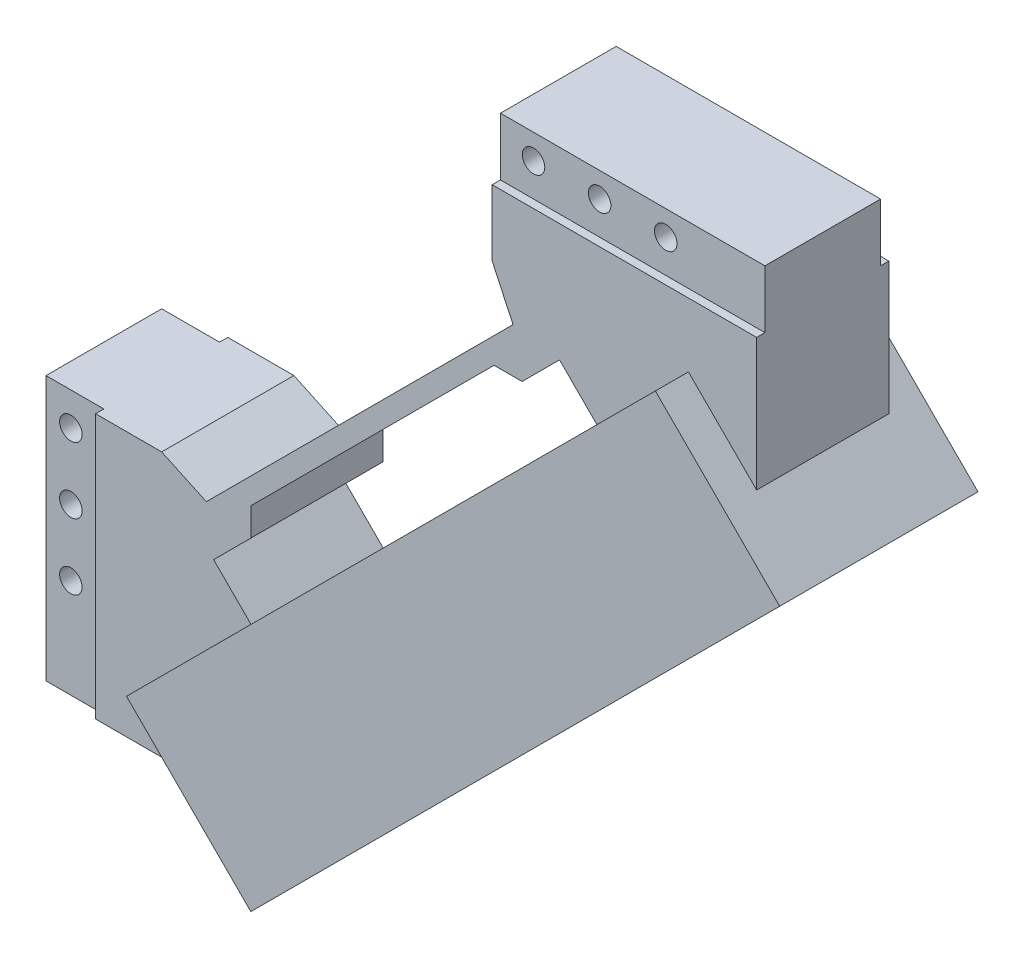
from build123d import *

# Parameters (mm, degrees)
SKETCH3_W                = 11.1125
SKETCH3_H                = 50.8
SKETCH3_W_2              = 50.8
SKETCH3_H_2              = 11.1125
BOSS_EXTRUDE2_DEPTH      = 25.4
SKETCH5_W                = 50.8
SKETCH5_H                = 12.7
SKETCH5_W_2              = 12.7
SKETCH5_H_2              = 50.8
CUT_EXTRUDE1_DEPTH       = 1.5875
SKETCH6_W                = 50.8
SKETCH6_H                = 12.7
SKETCH6_W_2              = 12.7
SKETCH6_H_2              = 50.8
CUT_EXTRUDE2_DEPTH       = 1.5875
SKETCH7_R                = 2.159
CUT_EXTRUDE4_DEPTH       = 25.4
F_3DSKETCH2_R            = 11.1125
F_3DSKETCH2_R_2          = 4.572
F_3DSKETCH2_R_3          = 19.05
F_3DSKETCH2_R_4          = 2.413
BOSS_EXTRUDE5_DEPTH      = 18.539434278
CUT_EXTRUDE9_START       = 89.71230509
CUT_EXTRUDE9_OUTLINE_R   = 4.572
CUT_EXTRUDE9_DEPTH       = 36.011280605
F_3DSKETCH2_11_R         = 2.413
CUT_EXTRUDE10_DEPTH      = 36.011280605
BOSS_EXTRUDE7_START      = -21.079434
SKETCH10_W               = 38.1
SKETCH10_H               = 143.684097938
SKETCH10_R               = 4.572
BOSS_EXTRUDE7_DEPTH      = 33.779434
CUT_EXTRUDE13_DEPTH      = 12.7
CUT_EXTRUDE13_DEPTH_BACK = 2.54
CUT_EXTRUDE14_DEPTH      = 12.7
SKETCH10_9_R             = 6.113994518
CUT_EXTRUDE15_DEPTH      = 4.064
SKETCH10_10_R            = 2.413
CUT_EXTRUDE16_DEPTH      = 18.288
CUT_EXTRUDE17_START      = -18.539434
F_3DSKETCH2_12_R         = 11.1125
F_3DSKETCH2_12_R_2       = 4.572
CUT_EXTRUDE17_DEPTH      = 7.1374
BOSS_EXTRUDE8_DEPTH      = 25.4
BOSS_EXTRUDE9_DEPTH      = 25.4
CUT_EXTRUDE18_DEPTH      = 18.288


# Read off the part's stored shape, not the designer's step: Cut-Extrude9
with BuildPart() as part:
    # Sketch3 → Boss-Extrude2 (new body)
    # profile 1 of 3: a face of its own
    with BuildSketch(Plane.XY):
        Polygon((139.7, -12.7), (88.9, -12.7), (88.9, -25.4), (95.186179285, -31.686179285), (92.898197138, -33.974161432), (33.974161432, -92.898197138), (31.605965948, -95.266392622), (25.4, -88.9), (12.7, -88.9), (12.7, -139.7), (38.1, -139.7), (139.7, -38.1), align=None)
        Polygon((109.017587951, -42.563692655), (42.563692655, -109.017587951), (35.379487758, -101.833383054), (32.685410922, -99.139306217), (42.563692655, -89.261024484), (89.261024484, -42.563692655), (99.139306217, -32.685410922), (101.833383054, -35.379487758), align=None, mode=Mode.SUBTRACT)
    # profile 2 of 3: a face of its own
    with BuildSketch(Plane.XY):
        with Locations((7.14375, -114.3)):
            Rectangle(SKETCH3_W, SKETCH3_H)
    # profile 3 of 3: a face of its own
    with BuildSketch(Plane.XY):
        with Locations((114.3, -7.14375)):
            Rectangle(SKETCH3_W_2, SKETCH3_H_2)
    extrude(amount=BOSS_EXTRUDE2_DEPTH)

    # Sketch5 → Cut-Extrude1 (cut)
    with BuildSketch(Plane.XY.offset(25.4)):
        with Locations((114.3, -6.35)):
            Rectangle(SKETCH5_W, SKETCH5_H)
        with Locations((6.35, -114.3)):
            Rectangle(SKETCH5_W_2, SKETCH5_H_2)
    extrude(amount=-CUT_EXTRUDE1_DEPTH, mode=Mode.SUBTRACT)

    # Sketch6 → Cut-Extrude2 (cut)
    with BuildSketch(Plane(origin=(0, 0, 0), x_dir=(-1, 0, 0), z_dir=(0, 0, -1))):
        with Locations((-114.3, -6.35)):
            Rectangle(SKETCH6_W, SKETCH6_H)
        with Locations((-6.35, -114.3)):
            Rectangle(SKETCH6_W_2, SKETCH6_H_2)
    extrude(amount=-CUT_EXTRUDE2_DEPTH, mode=Mode.SUBTRACT)

    # Sketch7 → Cut-Extrude4 (cut)
    with BuildSketch(Plane.XY.offset(25.4)):
        with Locations((95.25, -6.3627)):
            Circle(SKETCH7_R)
        with Locations((107.95, -6.3627)):
            Circle(SKETCH7_R)
        with Locations((120.65, -6.3627)):
            Circle(SKETCH7_R)
        with Locations((6.3627, -95.25)):
            Circle(SKETCH7_R)
        with Locations((6.3627, -107.95)):
            Circle(SKETCH7_R)
        with Locations((6.3627, -120.65)):
            Circle(SKETCH7_R)
    extrude(amount=-CUT_EXTRUDE4_DEPTH, mode=Mode.SUBTRACT)

    # 3DSketch2 → Boss-Extrude5 (add)
    # profile 1 of 3: a face of its own
    with BuildSketch(Plane(origin=(139.7, -38.1, 25.4), x_dir=(-0.6963106238227913, -0.6963106238227915, -0.17407765595569788), z_dir=(0.7071067811865477, -0.7071067811865475, 0))):
        with Locations((72.955945611, 0)):
            Circle(F_3DSKETCH2_R)
        with Locations((72.955945611, 0)):
            Circle(F_3DSKETCH2_R_2, mode=Mode.SUBTRACT)
    # profile 2 of 3: a face of its own
    with BuildSketch(Plane(origin=(139.7, -38.1, 25.4), x_dir=(-0.6963106238227913, -0.6963106238227915, -0.17407765595569788), z_dir=(0.7071067811865477, -0.7071067811865475, 0))):
        with Locations((72.955945611, 0)):
            Circle(F_3DSKETCH2_R_3)
    # profile 3 of 3: a face of its own
    with BuildSketch(Plane(origin=(139.7, -38.1, 25.4), x_dir=(-0.6963106238227913, -0.6963106238227915, -0.17407765595569788), z_dir=(0.7071067811865477, -0.7071067811865475, 0))):
        Polygon((0, 0), (4.421572461, 25.012190967), (145.911891222, 0), (141.490318761, -25.012190967), align=None)
        with Locations((47.943754644, 4.421572461)):
            Circle(F_3DSKETCH2_R_4, mode=Mode.SUBTRACT)
        with Locations((97.968136578, -4.421572461)):
            Circle(F_3DSKETCH2_R_4, mode=Mode.SUBTRACT)
    extrude(amount=-BOSS_EXTRUDE5_DEPTH)

    # Cut-Extrude9 outline → Cut-Extrude9 (cut)
    with BuildSketch(Plane(origin=(0, 0, 0), x_dir=(0.7071067811865471, 0.707106781186548, 0), z_dir=(0.707106781186548, -0.707106781186547, 0)).offset(CUT_EXTRUDE9_START)):
        with Locations((0, 12.7)):
            Circle(CUT_EXTRUDE9_OUTLINE_R)
    extrude(amount=CUT_EXTRUDE9_DEPTH, mode=Mode.SUBTRACT)

    # 3DSketch2<11> → Cut-Extrude10 (cut)
    with BuildSketch(Plane(origin=(106.860512242, -70.939487758, 12.7), x_dir=(-0.7071067811865474, -0.7071067811865477, 0), z_dir=(-0.7071067811865477, 0.7071067811865474, 0))):
        Circle(F_3DSKETCH2_11_R)
        with Locations((50.8, 0)):
            Circle(F_3DSKETCH2_11_R)
    extrude(amount=CUT_EXTRUDE10_DEPTH, mode=Mode.SUBTRACT)

    # Sketch10 → Boss-Extrude7 (add)
    with BuildSketch(Plane(origin=(90.696051224, -90.696051224, 0), x_dir=(0, 0, -1), z_dir=(0.7071067811865477, -0.7071067811865474, 0)).offset(BOSS_EXTRUDE7_START)):
        with Locations((-12.7, 0)):
            Rectangle(SKETCH10_W, SKETCH10_H)
        with BuildLine():
            Line((-17.581565793, -48.718798516), (-19.911684225, -26.144386078))
            ThreePointArc((-19.911684225, -26.144386078), (-12.7, -18.15), (-5.488315775, -26.144386078))
            Line((-5.488315775, -26.144386078), (-7.818434207, -48.718798516))
            ThreePointArc((-7.818434207, -48.718798516), (-12.7, -58.513994518), (-17.581565793, -48.718798516))
        make_face(mode=Mode.SUBTRACT)
        with Locations(Location((-12.7, 0, 0), (0, 0, 270))):
            Circle(SKETCH10_R, mode=Mode.SUBTRACT)
        with BuildLine():
            ThreePointArc((-17.581565793, 48.718798516), (-12.7, 58.513994518), (-7.818434207, 48.718798516))
            Line((-7.818434207, 48.718798516), (-5.488315775, 26.144386078))
            ThreePointArc((-5.488315775, 26.144386078), (-12.7, 18.15), (-19.911684225, 26.144386078))
            Line((-19.911684225, 26.144386078), (-17.581565793, 48.718798516))
        make_face(mode=Mode.SUBTRACT)
    extrude(amount=BOSS_EXTRUDE7_DEPTH)

    # Sketch10<7> → Cut-Extrude13 (cut, two sides: drawn at the far end of the back side and taken through both)
    with BuildSketch(Plane(origin=(90.696051224, -90.696051224, 0), x_dir=(0, 0, -1), z_dir=(0.7071067811865477, -0.7071067811865474, 0)).offset(-CUT_EXTRUDE13_DEPTH_BACK)):
        with BuildLine():
            Line((-25.6, -66.75), (0.2, -66.75))
            ThreePointArc((0.2, -66.75), (2.745584412, -65.695584412), (3.8, -63.15))
            Line((3.8, -63.15), (3.8, -13.05))
            ThreePointArc((3.8, -13.05), (2.745584412, -10.504415588), (0.2, -9.45))
            Line((0.2, -9.45), (-25.6, -9.45))
            ThreePointArc((-25.6, -9.45), (-28.145584412, -10.504415588), (-29.2, -13.05))
            Line((-29.2, -13.05), (-29.2, -63.15))
            ThreePointArc((-29.2, -63.15), (-28.145584412, -65.695584412), (-25.6, -66.75))
        make_face()
        with BuildLine():
            Line((0.2, 66.75), (-25.6, 66.75))
            ThreePointArc((-25.6, 66.75), (-28.145584412, 65.695584412), (-29.2, 63.15))
            Line((-29.2, 63.15), (-29.2, 13.05))
            ThreePointArc((-29.2, 13.05), (-28.145584412, 10.504415588), (-25.6, 9.45))
            Line((-25.6, 9.45), (0.2, 9.45))
            ThreePointArc((0.2, 9.45), (2.745584412, 10.504415588), (3.8, 13.05))
            Line((3.8, 13.05), (3.8, 63.15))
            ThreePointArc((3.8, 63.15), (2.745584412, 65.695584412), (0.2, 66.75))
        make_face()
    extrude(amount=CUT_EXTRUDE13_DEPTH + CUT_EXTRUDE13_DEPTH_BACK, mode=Mode.SUBTRACT)

    # Sketch10<8> → Cut-Extrude14 (cut)
    with BuildSketch(Plane(origin=(90.696051224, -90.696051224, 0), x_dir=(0, 0, -1), z_dir=(0.7071067811865477, -0.7071067811865474, 0))):
        with BuildLine():
            add(Edge.make_bspline(
                [(-15.540519599, 47.781955136), (-15.490532425, 47.73603869), (-15.388993168, 47.642768327), (-15.225337809, 47.510512218), (-15.05023378, 47.382424784), (-14.86286402, 47.260384175), (-14.663387192, 47.145452755), (-14.451810526, 47.038984645), (-14.180735408, 46.921767894), (-13.850558642, 46.808614587), (-13.464394399, 46.717629172), (-13.080676116, 46.662280095), (-12.825830882, 46.655545496), (-12.7, 46.65222026)],
                knots=[0, 0, 0, 0, 0.065342869, 0.132731377, 0.202172121, 0.273671089, 0.34723372, 0.422864961, 0.500569311, 0.630039386, 0.756419003, 0.879730881, 1, 1, 1, 1], degree=3))
            add(Edge.make_bspline(
                [(-12.7, 46.65222026), (-12.637418818, 46.653041537), (-12.511461207, 46.654694528), (-12.321734755, 46.668182489), (-12.130453667, 46.690076129), (-11.938071537, 46.721452131), (-11.745069681, 46.762353225), (-11.551961199, 46.813076509), (-11.359273202, 46.873817711), (-11.100574854, 46.96958434), (-10.788967012, 47.112379165), (-10.442976836, 47.31548274), (-10.132363887, 47.536777354), (-9.948826409, 47.701680377), (-9.859480401, 47.781955136)],
                knots=[0, 0, 0, 0, 0.059829934, 0.120420154, 0.181774032, 0.243894787, 0.306785488, 0.370449065, 0.434888311, 0.500105888, 0.634537507, 0.762645389, 0.884455823, 1, 1, 1, 1], degree=3))
            add(Edge.make_bspline(
                [(-9.859480401, 47.781955136), (-9.809926557, 47.830159757), (-9.712743706, 47.92469657), (-9.578577735, 48.072553471), (-9.456054231, 48.219998795), (-9.345191562, 48.366676585), (-9.21391821, 48.556721871), (-9.07151754, 48.793288336), (-8.927291666, 49.077918239), (-8.851279796, 49.271154552), (-8.81418569, 49.365454672)],
                knots=[0, 0, 0, 0, 0.108779889, 0.213334401, 0.313672693, 0.409804769, 0.501741655, 0.675682941, 0.841731935, 1, 1, 1, 1], degree=3))
            ThreePointArc((-8.81418569, 49.365454672), (-12.7, 54.942158031), (-16.58581431, 49.365454672))
            add(Edge.make_bspline(
                [(-16.58581431, 49.365454672), (-16.564153735, 49.308979836), (-16.520186479, 49.194345595), (-16.44362516, 49.023848207), (-16.357540355, 48.851983288), (-16.26071672, 48.679725849), (-16.137389358, 48.482854283), (-15.978837203, 48.261270581), (-15.776448009, 48.015668653), (-15.620912994, 47.861593799), (-15.540519599, 47.781955136)],
                knots=[0, 0, 0, 0, 0.094498647, 0.191816063, 0.291978629, 0.395010761, 0.500935114, 0.655694233, 0.822034222, 1, 1, 1, 1], degree=3))
        make_face()
        with BuildLine():
            ThreePointArc((-23.375261528, 35.545722635), (-25.960415941, 31.807672398), (-27.282722774, 27.45939141))
            Line((-27.282722774, 27.45939141), (-27.734823926, 25.480918405))
            ThreePointArc((-27.734823926, 25.480918405), (-27.742354252, 25.436649043), (-27.74487495, 25.391814589))
            Line((-27.74487495, 25.391814589), (-27.74487495, 17.827902311))
            add(Edge.make_bspline(
                [(-27.74487495, 17.827902311), (-27.74487495, 17.697556499), (-27.677913043, 17.571268418), (-27.464315845, 17.424786106), (-27.323061319, 17.407781693), (-27.201392579, 17.454544234)],
                knots=[0, 0, 0, 0, 0.000387965, 0.000387965, 0.00077593, 0.00077593, 0.00077593, 0.00077593], degree=3, weights=[1, 1, 1, 1, 1, 1]))
            ThreePointArc((-27.201392579, 17.454544234), (-25.735153586, 17.161089301), (-25.37342862, 15.710183504))
            add(Edge.make_bspline(
                [(-25.37342862, 15.710183504), (-25.405194241, 15.614372263), (-25.398958784, 15.508171677), (-25.315527042, 15.326534106), (-25.23920304, 15.252740582), (-25.145843703, 15.214362493)],
                knots=[0, 0, 0, 0, 0.000301952, 0.000301952, 0.000603904, 0.000603904, 0.000603904, 0.000603904], degree=3, weights=[1, 1, 1, 1, 1, 1]))
            ThreePointArc((-25.145843703, 15.214362493), (-24.439786176, 14.792159607), (-23.888695899, 14.181363394))
            add(Edge.make_bspline(
                [(-23.888695899, 14.181363394), (-23.84058364, 14.108747016), (-23.826397589, 14.016819684), (-23.850380907, 13.93307766)],
                knots=[0, 0, 0, 0, 0.000257617, 0.000257617, 0.000257617, 0.000257617], degree=3, weights=[1, 1, 1, 1]))
            ThreePointArc((-23.850380907, 13.93307766), (-23.575139467, 11.978075507), (-21.938295824, 10.874203161))
            Line((-21.938295824, 10.874203161), (-20.446740514, 10.611201717))
            ThreePointArc((-20.446740514, 10.611201717), (-20.412144857, 10.606647112), (-20.377283888, 10.60512505))
            Line((-20.377283888, 10.60512505), (-5.022716112, 10.60512505))
            ThreePointArc((-5.022716112, 10.60512505), (-4.987855143, 10.606647112), (-4.953259486, 10.611201717))
            Line((-4.953259486, 10.611201717), (-3.461704176, 10.874203161))
            ThreePointArc((-3.461704176, 10.874203161), (-1.824860533, 11.978075507), (-1.549619093, 13.93307766))
            add(Edge.make_bspline(
                [(-1.549619093, 13.93307766), (-1.573602413, 14.016819693), (-1.559416355, 14.108747024), (-1.511304101, 14.181363394)],
                knots=[0, 0, 0, 0, 0.000257617, 0.000257617, 0.000257617, 0.000257617], degree=3, weights=[1, 1, 1, 1]))
            ThreePointArc((-1.511304101, 14.181363394), (-0.960213824, 14.792159607), (-0.254156297, 15.214362493))
            add(Edge.make_bspline(
                [(-0.254156297, 15.214362493), (-0.160796937, 15.252740591), (-0.084334773, 15.326706684), (-0.001000449, 15.50838897), (0.005194234, 15.614372286), (-0.02657138, 15.710183504)],
                knots=[0, 0, 0, 0, 0.000301952, 0.000301952, 0.000603904, 0.000603904, 0.000603904, 0.000603904], degree=3, weights=[1, 1, 1, 1, 1, 1]))
            ThreePointArc((-0.02657138, 15.710183504), (0.335153586, 17.161089301), (1.801392579, 17.454544234))
            add(Edge.make_bspline(
                [(1.801392579, 17.454544234), (1.923061366, 17.407781675), (2.06496564, 17.42497916), (2.278326365, 17.571805697), (2.34487495, 17.697556549), (2.34487495, 17.827902311)],
                knots=[0, 0, 0, 0, 0.000387965, 0.000387965, 0.00077593, 0.00077593, 0.00077593, 0.00077593], degree=3, weights=[1, 1, 1, 1, 1, 1]))
            Line((2.34487495, 17.827902311), (2.34487495, 25.391814589))
            ThreePointArc((2.34487495, 25.391814589), (2.342354252, 25.436649043), (2.334823926, 25.480918405))
            Line((2.334823926, 25.480918405), (1.882722774, 27.45939141))
            ThreePointArc((1.882722774, 27.45939141), (0.560415941, 31.807672398), (-2.024738472, 35.545722635))
            add(Edge.make_bspline(
                [(-2.024738472, 35.545722635), (-2.073045795, 35.596551277), (-2.101978364, 35.662728517), (-2.111257506, 35.802216956), (-2.091202658, 35.871983484), (-2.049985751, 35.92871369)],
                knots=[0, 0, 0, 0, 0.000207381, 0.000207381, 0.000414763, 0.000414763, 0.000414763, 0.000414763], degree=3, weights=[1, 1, 1, 1, 1, 1]))
            Line((-2.049985751, 35.92871369), (-1.919397276, 36.108453306))
            ThreePointArc((-1.919397276, 36.108453306), (-2.456419606, 39.499078855), (-5.847045155, 38.962056525))
            Line((-5.847045155, 38.962056525), (-6.037411672, 38.700039494))
            add(Edge.make_bspline(
                [(-6.037411672, 38.700039494), (-6.078590921, 38.643361119), (-6.138347451, 38.602917009), (-6.273703714, 38.568422661), (-6.345876647, 38.575410319), (-6.40912486, 38.605540598)],
                knots=[0, 0, 0, 0, 0.000207192, 0.000207192, 0.000414384, 0.000414384, 0.000414384, 0.000414384], degree=3, weights=[1, 1, 1, 1, 1, 1]))
            ThreePointArc((-6.40912486, 38.605540598), (-12.7, 40.027419885), (-18.99087514, 38.605540598))
            add(Edge.make_bspline(
                [(-18.99087514, 38.605540598), (-19.054123344, 38.575410324), (-19.125940061, 38.568415461), (-19.261336137, 38.602753207), (-19.321409073, 38.643361112), (-19.362588328, 38.700039494)],
                knots=[0, 0, 0, 0, 0.000207192, 0.000207192, 0.000414384, 0.000414384, 0.000414384, 0.000414384], degree=3, weights=[1, 1, 1, 1, 1, 1]))
            Line((-19.362588328, 38.700039494), (-19.552954845, 38.962056525))
            ThreePointArc((-19.552954845, 38.962056525), (-22.943580394, 39.499078855), (-23.480602724, 36.108453306))
            Line((-23.480602724, 36.108453306), (-23.350014249, 35.92871369))
            add(Edge.make_bspline(
                [(-23.350014249, 35.92871369), (-23.308797348, 35.871983492), (-23.288802383, 35.802580884), (-23.297914493, 35.663081434), (-23.326954198, 35.596551285), (-23.375261528, 35.545722635)],
                knots=[0, 0, 0, 0, 0.000207381, 0.000207381, 0.000414763, 0.000414763, 0.000414763, 0.000414763], degree=3, weights=[1, 1, 1, 1, 1, 1]))
        make_face()
        with BuildLine():
            Line((-27.74487495, -17.827902311), (-27.74487495, -25.391814589))
            ThreePointArc((-27.74487495, -25.391814589), (-27.742354252, -25.436649043), (-27.734823926, -25.480918405))
            Line((-27.734823926, -25.480918405), (-27.282722774, -27.45939141))
            ThreePointArc((-27.282722774, -27.45939141), (-25.960415941, -31.807672398), (-23.375261528, -35.545722635))
            add(Edge.make_bspline(
                [(-23.375261528, -35.545722635), (-23.326954205, -35.596551277), (-23.298021636, -35.662728517), (-23.288742494, -35.802216956), (-23.308797342, -35.871983484), (-23.350014249, -35.92871369)],
                knots=[0, 0, 0, 0, 0.000207381, 0.000207381, 0.000414763, 0.000414763, 0.000414763, 0.000414763], degree=3, weights=[1, 1, 1, 1, 1, 1]))
            Line((-23.350014249, -35.92871369), (-23.480602724, -36.108453306))
            ThreePointArc((-23.480602724, -36.108453306), (-22.943580394, -39.499078855), (-19.552954845, -38.962056525))
            Line((-19.552954845, -38.962056525), (-19.362588328, -38.700039494))
            add(Edge.make_bspline(
                [(-19.362588328, -38.700039494), (-19.321409079, -38.643361119), (-19.261652549, -38.602917009), (-19.126296286, -38.568422661), (-19.054123353, -38.575410319), (-18.99087514, -38.605540598)],
                knots=[0, 0, 0, 0, 0.000207192, 0.000207192, 0.000414384, 0.000414384, 0.000414384, 0.000414384], degree=3, weights=[1, 1, 1, 1, 1, 1]))
            ThreePointArc((-18.99087514, -38.605540598), (-12.7, -40.027419885), (-6.40912486, -38.605540598))
            add(Edge.make_bspline(
                [(-6.40912486, -38.605540598), (-6.345876656, -38.575410324), (-6.274059939, -38.568415461), (-6.138663863, -38.602753207), (-6.078590927, -38.643361112), (-6.037411672, -38.700039494)],
                knots=[0, 0, 0, 0, 0.000207192, 0.000207192, 0.000414384, 0.000414384, 0.000414384, 0.000414384], degree=3, weights=[1, 1, 1, 1, 1, 1]))
            Line((-6.037411672, -38.700039494), (-5.847045155, -38.962056525))
            ThreePointArc((-5.847045155, -38.962056525), (-2.456419606, -39.499078855), (-1.919397276, -36.108453306))
            Line((-1.919397276, -36.108453306), (-2.049985751, -35.92871369))
            add(Edge.make_bspline(
                [(-2.049985751, -35.92871369), (-2.091202652, -35.871983492), (-2.111197617, -35.802580884), (-2.102085507, -35.663081434), (-2.073045802, -35.596551285), (-2.024738472, -35.545722635)],
                knots=[0, 0, 0, 0, 0.000207381, 0.000207381, 0.000414763, 0.000414763, 0.000414763, 0.000414763], degree=3, weights=[1, 1, 1, 1, 1, 1]))
            ThreePointArc((-2.024738472, -35.545722635), (0.560415941, -31.807672398), (1.882722774, -27.45939141))
            Line((1.882722774, -27.45939141), (2.334823926, -25.480918405))
            ThreePointArc((2.334823926, -25.480918405), (2.342354252, -25.436649043), (2.34487495, -25.391814589))
            Line((2.34487495, -25.391814589), (2.34487495, -17.827902311))
            add(Edge.make_bspline(
                [(2.34487495, -17.827902311), (2.34487495, -17.697556499), (2.277913043, -17.571268418), (2.064315845, -17.424786106), (1.923061319, -17.407781693), (1.801392579, -17.454544234)],
                knots=[0, 0, 0, 0, 0.000387965, 0.000387965, 0.00077593, 0.00077593, 0.00077593, 0.00077593], degree=3, weights=[1, 1, 1, 1, 1, 1]))
            ThreePointArc((1.801392579, -17.454544234), (0.335153586, -17.161089301), (-0.02657138, -15.710183504))
            add(Edge.make_bspline(
                [(-0.02657138, -15.710183504), (0.005194241, -15.614372263), (-0.001041216, -15.508171677), (-0.084472958, -15.326534106), (-0.16079696, -15.252740582), (-0.254156297, -15.214362493)],
                knots=[0, 0, 0, 0, 0.000301952, 0.000301952, 0.000603904, 0.000603904, 0.000603904, 0.000603904], degree=3, weights=[1, 1, 1, 1, 1, 1]))
            ThreePointArc((-0.254156297, -15.214362493), (-0.960213824, -14.792159607), (-1.511304101, -14.181363394))
            add(Edge.make_bspline(
                [(-1.511304101, -14.181363394), (-1.55941636, -14.108747016), (-1.573602411, -14.016819684), (-1.549619093, -13.93307766)],
                knots=[0, 0, 0, 0, 0.000257617, 0.000257617, 0.000257617, 0.000257617], degree=3, weights=[1, 1, 1, 1]))
            ThreePointArc((-1.549619093, -13.93307766), (-1.824860533, -11.978075507), (-3.461704176, -10.874203161))
            Line((-3.461704176, -10.874203161), (-4.953259486, -10.611201717))
            ThreePointArc((-4.953259486, -10.611201717), (-4.987855143, -10.606647112), (-5.022716112, -10.60512505))
            Line((-5.022716112, -10.60512505), (-20.377283888, -10.60512505))
            ThreePointArc((-20.377283888, -10.60512505), (-20.412144857, -10.606647112), (-20.446740514, -10.611201717))
            Line((-20.446740514, -10.611201717), (-21.938295824, -10.874203161))
            ThreePointArc((-21.938295824, -10.874203161), (-23.575139467, -11.978075507), (-23.850380907, -13.93307766))
            add(Edge.make_bspline(
                [(-23.850380907, -13.93307766), (-23.826397587, -14.016819693), (-23.840583645, -14.108747024), (-23.888695899, -14.181363394)],
                knots=[0, 0, 0, 0, 0.000257617, 0.000257617, 0.000257617, 0.000257617], degree=3, weights=[1, 1, 1, 1]))
            ThreePointArc((-23.888695899, -14.181363394), (-24.439786176, -14.792159607), (-25.145843703, -15.214362493))
            add(Edge.make_bspline(
                [(-25.145843703, -15.214362493), (-25.239203063, -15.252740591), (-25.315665227, -15.326706684), (-25.398999551, -15.50838897), (-25.405194234, -15.614372286), (-25.37342862, -15.710183504)],
                knots=[0, 0, 0, 0, 0.000301952, 0.000301952, 0.000603904, 0.000603904, 0.000603904, 0.000603904], degree=3, weights=[1, 1, 1, 1, 1, 1]))
            ThreePointArc((-25.37342862, -15.710183504), (-25.735153586, -17.161089301), (-27.201392579, -17.454544234))
            add(Edge.make_bspline(
                [(-27.201392579, -17.454544234), (-27.323061366, -17.407781675), (-27.46496564, -17.42497916), (-27.678326365, -17.571805697), (-27.74487495, -17.697556549), (-27.74487495, -17.827902311)],
                knots=[0, 0, 0, 0, 0.000387965, 0.000387965, 0.00077593, 0.00077593, 0.00077593, 0.00077593], degree=3, weights=[1, 1, 1, 1, 1, 1]))
        make_face()
        with BuildLine():
            ThreePointArc((-16.58581431, -49.365454672), (-12.7, -54.942158031), (-8.81418569, -49.365454672))
            add(Edge.make_bspline(
                [(-8.81418569, -49.365454672), (-8.835846265, -49.308979836), (-8.879813521, -49.194345595), (-8.95637484, -49.023848207), (-9.042459645, -48.851983288), (-9.13928328, -48.679725849), (-9.262610642, -48.482854283), (-9.421162797, -48.261270581), (-9.623551991, -48.015668653), (-9.779087006, -47.861593799), (-9.859480401, -47.781955136)],
                knots=[0, 0, 0, 0, 0.094498647, 0.191816063, 0.291978629, 0.395010761, 0.500935114, 0.655694233, 0.822034222, 1, 1, 1, 1], degree=3))
            add(Edge.make_bspline(
                [(-9.859480401, -47.781955136), (-9.909467575, -47.73603869), (-10.011006832, -47.642768327), (-10.174662191, -47.510512218), (-10.34976622, -47.382424784), (-10.53713598, -47.260384175), (-10.736612808, -47.145452755), (-10.948189474, -47.038984645), (-11.219264592, -46.921767894), (-11.549441358, -46.808614587), (-11.935605601, -46.717629172), (-12.319323884, -46.662280095), (-12.574169118, -46.655545496), (-12.7, -46.65222026)],
                knots=[0, 0, 0, 0, 0.065342869, 0.132731377, 0.202172121, 0.273671089, 0.34723372, 0.422864961, 0.500569311, 0.630039386, 0.756419003, 0.879730881, 1, 1, 1, 1], degree=3))
            add(Edge.make_bspline(
                [(-12.7, -46.65222026), (-12.762581182, -46.653041537), (-12.888538793, -46.654694528), (-13.078265245, -46.668182489), (-13.269546333, -46.690076129), (-13.461928463, -46.721452131), (-13.654930319, -46.762353225), (-13.848038801, -46.813076509), (-14.040726798, -46.873817711), (-14.299425146, -46.96958434), (-14.611032988, -47.112379165), (-14.957023164, -47.31548274), (-15.267636113, -47.536777354), (-15.451173591, -47.701680377), (-15.540519599, -47.781955136)],
                knots=[0, 0, 0, 0, 0.059829934, 0.120420154, 0.181774032, 0.243894787, 0.306785488, 0.370449065, 0.434888311, 0.500105888, 0.634537507, 0.762645389, 0.884455823, 1, 1, 1, 1], degree=3))
            add(Edge.make_bspline(
                [(-15.540519599, -47.781955136), (-15.590073443, -47.830159757), (-15.687256294, -47.92469657), (-15.821422265, -48.072553471), (-15.943945769, -48.219998795), (-16.054808438, -48.366676585), (-16.18608179, -48.556721871), (-16.32848246, -48.793288336), (-16.472708334, -49.077918239), (-16.548720204, -49.271154552), (-16.58581431, -49.365454672)],
                knots=[0, 0, 0, 0, 0.108779889, 0.213334401, 0.313672693, 0.409804769, 0.501741655, 0.675682941, 0.841731935, 1, 1, 1, 1], degree=3))
        make_face()
    extrude(amount=-CUT_EXTRUDE14_DEPTH, mode=Mode.SUBTRACT)

    # Sketch10<9> → Cut-Extrude15 (cut)
    with BuildSketch(Plane(origin=(90.696051224, -90.696051224, 0), x_dir=(0, 0, -1), z_dir=(0.7071067811865477, -0.7071067811865474, 0))):
        with Locations(Location((-12.7, -52.4, 0), (0, 0, 90))):
            Circle(SKETCH10_9_R)
        with Locations(Location((-12.7, 52.4, 0), (0, 0, 90))):
            Circle(SKETCH10_9_R)
    extrude(amount=-CUT_EXTRUDE15_DEPTH, mode=Mode.SUBTRACT)

    # Sketch10<10> → Cut-Extrude16 (cut)
    # profile 1 of 2: a face of its own
    with BuildSketch(Plane(origin=(90.696051224, -90.696051224, 0), x_dir=(0, 0, -1), z_dir=(0.7071067811865477, -0.7071067811865474, 0))):
        with BuildLine():
            Line((-5.488315775, 26.144386078), (-6.792715016, 38.781531924))
            ThreePointArc((-6.792715016, 38.781531924), (-12.7, 40.027419885), (-18.607284984, 38.781531924))
            Line((-18.607284984, 38.781531924), (-19.911684225, 26.144386078))
            ThreePointArc((-19.911684225, 26.144386078), (-18.083274982, 20.543782288), (-12.7, 18.15))
            ThreePointArc((-12.7, 18.15), (-7.316725018, 20.543782288), (-5.488315775, 26.144386078))
        make_face()
        with Locations(Location((-12.7, 25.4, 0), (0, 0, 270))):
            Circle(SKETCH10_10_R, mode=Mode.SUBTRACT)
    # profile 2 of 2: a face of its own
    with BuildSketch(Plane(origin=(90.696051224, -90.696051224, 0), x_dir=(0, 0, -1), z_dir=(0.7071067811865477, -0.7071067811865474, 0))):
        with BuildLine():
            Line((-19.911684225, -26.144386078), (-18.607284984, -38.781531924))
            ThreePointArc((-18.607284984, -38.781531924), (-12.7, -40.027419885), (-6.792715016, -38.781531924))
            Line((-6.792715016, -38.781531924), (-5.488315775, -26.144386078))
            ThreePointArc((-5.488315775, -26.144386078), (-7.316725018, -20.543782288), (-12.7, -18.15))
            ThreePointArc((-12.7, -18.15), (-18.083274982, -20.543782288), (-19.911684225, -26.144386078))
        make_face()
        with Locations(Location((-12.7, -25.4, 0), (0, 0, 270))):
            Circle(SKETCH10_10_R, mode=Mode.SUBTRACT)
    extrude(amount=-CUT_EXTRUDE16_DEPTH, mode=Mode.SUBTRACT)

    # 3DSketch2<12> → Cut-Extrude17 (cut)
    with BuildSketch(Plane(origin=(139.7, -38.1, 25.4), x_dir=(-0.6963106238227913, -0.6963106238227915, -0.17407765595569788), z_dir=(0.7071067811865477, -0.7071067811865475, 0)).offset(CUT_EXTRUDE17_START)):
        with Locations(Location((72.955945611, 0, 0), (0, 0, 169.975012138))):
            Circle(F_3DSKETCH2_12_R)
        with Locations(Location((72.955945611, 0, 0), (0, 0, 349.975012138))):
            Circle(F_3DSKETCH2_12_R_2, mode=Mode.SUBTRACT)
    extrude(amount=CUT_EXTRUDE17_DEPTH, mode=Mode.SUBTRACT)

    # Sketch3<6> → Boss-Extrude8 (add)
    with BuildSketch(Plane.XY):
        Polygon((94.649178157, -42.563692655), (101.833383054, -35.379487758), (99.139306217, -32.685410922), (89.261024484, -42.563692655), align=None)
        Polygon((32.685410922, -99.139306217), (35.379487758, -101.833383054), (42.563692655, -94.649178157), (42.563692655, -89.261024484), align=None)
    extrude(amount=BOSS_EXTRUDE8_DEPTH)

    # Sketch3<7> → Boss-Extrude9 (add)
    with BuildSketch(Plane.XY):
        Polygon((33.974161432, -92.898197138), (25.4, -88.9), (31.605965948, -95.266392622), align=None)
        Polygon((95.186179285, -31.686179285), (88.9, -25.4), (92.898197138, -33.974161432), align=None)
    extrude(amount=BOSS_EXTRUDE9_DEPTH)

    # Sketch10<11> → Cut-Extrude18 (cut)
    with BuildSketch(Plane(origin=(90.696051224, -90.696051224, 0), x_dir=(0, 0, -1), z_dir=(0.7071067811865477, -0.7071067811865474, 0))):
        with BuildLine():
            ThreePointArc((-16.58581431, -49.365454672), (-12.7, -54.942158031), (-8.81418569, -49.365454672))
            add(Edge.make_bspline(
                [(-8.81418569, -49.365454672), (-8.835846265, -49.308979836), (-8.879813521, -49.194345595), (-8.95637484, -49.023848207), (-9.042459645, -48.851983288), (-9.13928328, -48.679725849), (-9.262610642, -48.482854283), (-9.421162797, -48.261270581), (-9.623551991, -48.015668653), (-9.779087006, -47.861593799), (-9.859480401, -47.781955136)],
                knots=[0, 0, 0, 0, 0.094498647, 0.191816063, 0.291978629, 0.395010761, 0.500935114, 0.655694233, 0.822034222, 1, 1, 1, 1], degree=3))
            add(Edge.make_bspline(
                [(-9.859480401, -47.781955136), (-9.909467575, -47.73603869), (-10.011006832, -47.642768327), (-10.174662191, -47.510512218), (-10.34976622, -47.382424784), (-10.53713598, -47.260384175), (-10.736612808, -47.145452755), (-10.948189474, -47.038984645), (-11.219264592, -46.921767894), (-11.549441358, -46.808614587), (-11.935605601, -46.717629172), (-12.319323884, -46.662280095), (-12.574169118, -46.655545496), (-12.7, -46.65222026)],
                knots=[0, 0, 0, 0, 0.065342869, 0.132731377, 0.202172121, 0.273671089, 0.34723372, 0.422864961, 0.500569311, 0.630039386, 0.756419003, 0.879730881, 1, 1, 1, 1], degree=3))
            add(Edge.make_bspline(
                [(-12.7, -46.65222026), (-12.762581182, -46.653041537), (-12.888538793, -46.654694528), (-13.078265245, -46.668182489), (-13.269546333, -46.690076129), (-13.461928463, -46.721452131), (-13.654930319, -46.762353225), (-13.848038801, -46.813076509), (-14.040726798, -46.873817711), (-14.299425146, -46.96958434), (-14.611032988, -47.112379165), (-14.957023164, -47.31548274), (-15.267636113, -47.536777354), (-15.451173591, -47.701680377), (-15.540519599, -47.781955136)],
                knots=[0, 0, 0, 0, 0.059829934, 0.120420154, 0.181774032, 0.243894787, 0.306785488, 0.370449065, 0.434888311, 0.500105888, 0.634537507, 0.762645389, 0.884455823, 1, 1, 1, 1], degree=3))
            add(Edge.make_bspline(
                [(-15.540519599, -47.781955136), (-15.590073443, -47.830159757), (-15.687256294, -47.92469657), (-15.821422265, -48.072553471), (-15.943945769, -48.219998795), (-16.054808438, -48.366676585), (-16.18608179, -48.556721871), (-16.32848246, -48.793288336), (-16.472708334, -49.077918239), (-16.548720204, -49.271154552), (-16.58581431, -49.365454672)],
                knots=[0, 0, 0, 0, 0.108779889, 0.213334401, 0.313672693, 0.409804769, 0.501741655, 0.675682941, 0.841731935, 1, 1, 1, 1], degree=3))
        make_face()
        with BuildLine():
            ThreePointArc((-8.81418569, 49.365454672), (-12.7, 54.942158031), (-16.58581431, 49.365454672))
            add(Edge.make_bspline(
                [(-16.58581431, 49.365454672), (-16.564153735, 49.308979836), (-16.520186479, 49.194345595), (-16.44362516, 49.023848207), (-16.357540355, 48.851983288), (-16.26071672, 48.679725849), (-16.137389358, 48.482854283), (-15.978837203, 48.261270581), (-15.776448009, 48.015668653), (-15.620912994, 47.861593799), (-15.540519599, 47.781955136)],
                knots=[0, 0, 0, 0, 0.094498647, 0.191816063, 0.291978629, 0.395010761, 0.500935114, 0.655694233, 0.822034222, 1, 1, 1, 1], degree=3))
            add(Edge.make_bspline(
                [(-15.540519599, 47.781955136), (-15.490532425, 47.73603869), (-15.388993168, 47.642768327), (-15.225337809, 47.510512218), (-15.05023378, 47.382424784), (-14.86286402, 47.260384175), (-14.663387192, 47.145452755), (-14.451810526, 47.038984645), (-14.180735408, 46.921767894), (-13.850558642, 46.808614587), (-13.464394399, 46.717629172), (-13.080676116, 46.662280095), (-12.825830882, 46.655545496), (-12.7, 46.65222026)],
                knots=[0, 0, 0, 0, 0.065342869, 0.132731377, 0.202172121, 0.273671089, 0.34723372, 0.422864961, 0.500569311, 0.630039386, 0.756419003, 0.879730881, 1, 1, 1, 1], degree=3))
            add(Edge.make_bspline(
                [(-12.7, 46.65222026), (-12.637418818, 46.653041537), (-12.511461207, 46.654694528), (-12.321734755, 46.668182489), (-12.130453667, 46.690076129), (-11.938071537, 46.721452131), (-11.745069681, 46.762353225), (-11.551961199, 46.813076509), (-11.359273202, 46.873817711), (-11.100574854, 46.96958434), (-10.788967012, 47.112379165), (-10.442976836, 47.31548274), (-10.132363887, 47.536777354), (-9.948826409, 47.701680377), (-9.859480401, 47.781955136)],
                knots=[0, 0, 0, 0, 0.059829934, 0.120420154, 0.181774032, 0.243894787, 0.306785488, 0.370449065, 0.434888311, 0.500105888, 0.634537507, 0.762645389, 0.884455823, 1, 1, 1, 1], degree=3))
            add(Edge.make_bspline(
                [(-9.859480401, 47.781955136), (-9.809926557, 47.830159757), (-9.712743706, 47.92469657), (-9.578577735, 48.072553471), (-9.456054231, 48.219998795), (-9.345191562, 48.366676585), (-9.21391821, 48.556721871), (-9.07151754, 48.793288336), (-8.927291666, 49.077918239), (-8.851279796, 49.271154552), (-8.81418569, 49.365454672)],
                knots=[0, 0, 0, 0, 0.108779889, 0.213334401, 0.313672693, 0.409804769, 0.501741655, 0.675682941, 0.841731935, 1, 1, 1, 1], degree=3))
        make_face()
    extrude(amount=-CUT_EXTRUDE18_DEPTH, mode=Mode.SUBTRACT)


solid = part.part
